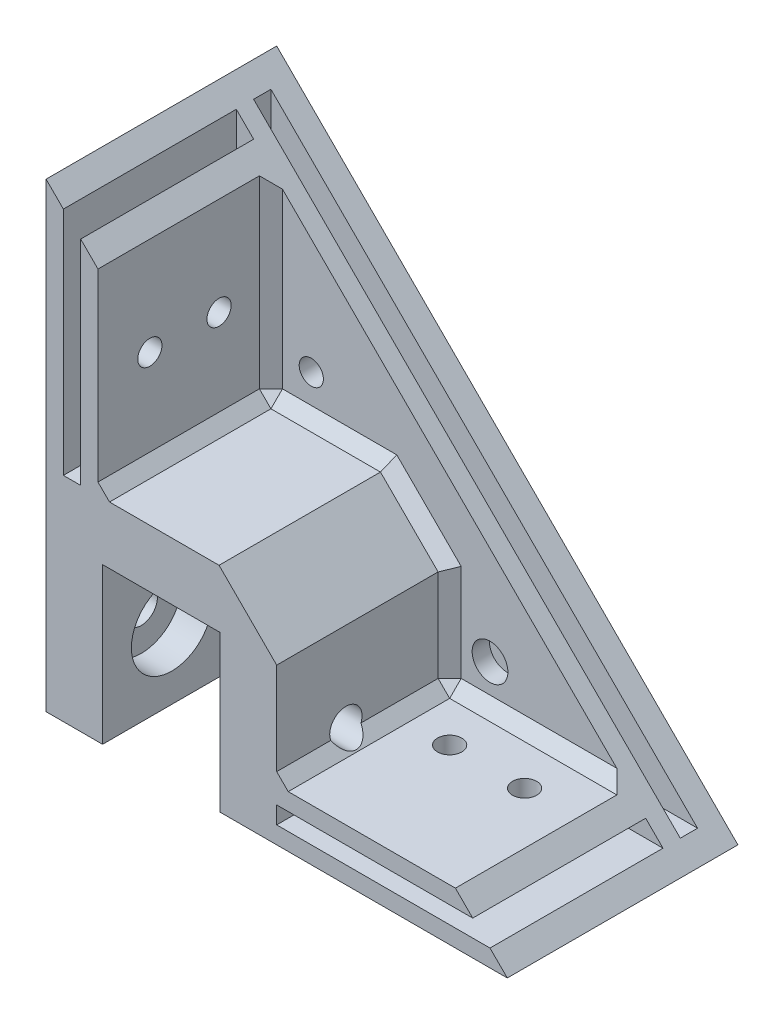
from build123d import *

# Parameters (mm, degrees)
DODANIE_WYCI_GNI_CIE1_DEPTH     = 4
DODANIE_WYCI_GNI_CIE2_DEPTH     = 3
DODANIE_WYCI_GNI_CIE3_DEPTH     = 3
DODANIE_WYCI_GNI_CIE4_DEPTH     = 30
WYTNIJ_WYCI_GNI_CIE1_DEPTH      = 15.5
WYTNIJ_WYCI_GNI_CIE1_DEPTH_BACK = 15.5
SZKIC5_R                        = 7
SZKIC6_R                        = 2.802594562
WYTNIJ_WYCI_GNI_CIE2_DEPTH      = 121
SFAZOWANIE1_SIZE                = 2
SZKIC7_R                        = 3.1
SZKIC7_R_2                      = 2.1
WYTNIJ_WYCI_GNI_CIE3_DEPTH      = 118.046999107
SZKIC8_R                        = 2.1
WYTNIJ_WYCI_GNI_CIE4_DEPTH      = 115.197197864
SZKIC9_R                        = 2.1
WYTNIJ_WYCI_GNI_CIE5_DEPTH      = 115.197197864


with BuildPart() as part:
    # Szkic1 → Dodanie-wyciągnięcie1 (new body)
    with BuildSketch(Plane.XY):
        Polygon((0, 0), (80, 0), (0, 80), align=None)
    extrude(amount=DODANIE_WYCI_GNI_CIE1_DEPTH)

    # Szkic2 → Dodanie-wyciągnięcie2 (add)
    with BuildSketch(Plane.XY.offset(4)):
        Polygon((3, 77), (3, 3), (77, 3), (80, 0), (0, 0), (0, 80), align=None)
    extrude(amount=DODANIE_WYCI_GNI_CIE2_DEPTH)

    # Szkic3 → Dodanie-wyciągnięcie3 (add)
    with BuildSketch(Plane.XY.offset(7)):
        Polygon((80, 0), (77, 3), (3, 77), (0, 80), (0, 0), align=None)
    extrude(amount=DODANIE_WYCI_GNI_CIE3_DEPTH)

    # Szkic4 → Dodanie-wyciągnięcie4 (add)
    with BuildSketch(Plane.XY.offset(10)):
        Polygon((30.2, 0), (80, 0), (77, 3), (40, 3), (40, 6), (74, 6), (71, 9), (40, 9), (40, 27), (30, 37), (9, 37), (9, 71), (6, 74), (6, 37), (3, 37), (3, 77), (0, 80), (0, 0), (9.8, 0), (9.8, 27), (30.2, 27), align=None)
    extrude(amount=DODANIE_WYCI_GNI_CIE4_DEPTH)

    # Szkic5 → Wytnij-wyciągnięcie1 (cut, two sides: drawn at the far end of the back side and taken through both)
    with BuildSketch(Plane(origin=(20, 0, 0), x_dir=(0, 0, -1), z_dir=(1, 0, 0)).offset(-WYTNIJ_WYCI_GNI_CIE1_DEPTH_BACK)):
        with Locations((-28, 12)):
            Circle(SZKIC5_R)
    extrude(amount=WYTNIJ_WYCI_GNI_CIE1_DEPTH + WYTNIJ_WYCI_GNI_CIE1_DEPTH_BACK, mode=Mode.SUBTRACT)

    # Szkic6 → Wytnij-wyciągnięcie2 (cut, through all)
    with BuildSketch(Plane.ZY):
        with Locations((28, 12)):
            Circle(SZKIC6_R)
    extrude(amount=-WYTNIJ_WYCI_GNI_CIE2_DEPTH, mode=Mode.SUBTRACT)

    # Sfazowanie1
    # the kernel refuses this chamfer: 2 mm, written as the material it adds along each edge
    with BuildSketch(Plane(origin=(10.333333333, 38.333333333, 11.333333333), x_dir=(-0.7071067811865475, 0.7071067811865475, 0), z_dir=(-0.5773502691896258, -0.5773502691896258, -0.5773502691896258))) as sfazowanie1_piece_1_section:
        Polygon((-1.414213562, -0.816496581), (1.414213562, -0.816496581), (0, 1.632993162), align=None)
    sfazowanie1_piece_1 = extrude(amount=2.540341184, mode=Mode.PRIVATE)
    sfazowanie1_piece_1 = split(sfazowanie1_piece_1, bisect_by=Plane(origin=(9, 37, 10), z_dir=(0, 1, 0)), keep=Keep.TOP, mode=Mode.PRIVATE)
    sfazowanie1_piece_1 = split(sfazowanie1_piece_1, bisect_by=Plane(origin=(9, 37, 10), z_dir=(1, 0, 0)), keep=Keep.TOP, mode=Mode.PRIVATE)
    sfazowanie1_piece_1 = split(sfazowanie1_piece_1, bisect_by=Plane(origin=(9, 37, 10), z_dir=(0, 0, 1)), keep=Keep.TOP, mode=Mode.PRIVATE)
    add(sfazowanie1_piece_1)
    with BuildSketch(Plane(origin=(41.333333333, 10.333333333, 11.333333333), x_dir=(0, -0.7071067811865475, 0.7071067811865475), z_dir=(-0.5773502691896258, -0.5773502691896258, -0.5773502691896258))) as sfazowanie1_piece_2_section:
        Polygon((-1.414213562, -0.816496581), (1.414213562, -0.816496581), (0, 1.632993162), align=None)
    sfazowanie1_piece_2 = extrude(amount=2.540341184, mode=Mode.PRIVATE)
    sfazowanie1_piece_2 = split(sfazowanie1_piece_2, bisect_by=Plane(origin=(40, 9, 10), z_dir=(0, 0, 1)), keep=Keep.TOP, mode=Mode.PRIVATE)
    sfazowanie1_piece_2 = split(sfazowanie1_piece_2, bisect_by=Plane(origin=(40, 9, 10), z_dir=(0, 1, 0)), keep=Keep.TOP, mode=Mode.PRIVATE)
    sfazowanie1_piece_2 = split(sfazowanie1_piece_2, bisect_by=Plane(origin=(40, 9, 10), z_dir=(1, 0, 0)), keep=Keep.TOP, mode=Mode.PRIVATE)
    add(sfazowanie1_piece_2)
    with BuildSketch(Plane(origin=(9, 37, 4.856634024), x_dir=(1, 0, 0), z_dir=(0, 0, 1))) as sfazowanie1_piece_3_section:
        Polygon((SFAZOWANIE1_SIZE, 0), (0, SFAZOWANIE1_SIZE), (0, 0), align=None)
    sfazowanie1_piece_3 = extrude(amount=35.143365976, mode=Mode.PRIVATE)
    sfazowanie1_piece_3 = split(sfazowanie1_piece_3, bisect_by=Plane(origin=(9, 37, 7), z_dir=(0, 0, 1)), keep=Keep.TOP, mode=Mode.PRIVATE)
    add(sfazowanie1_piece_3)
    with BuildSketch(Plane(origin=(76.143365976, 9, 10), x_dir=(0, 0, 1), z_dir=(-1, 0, 0))) as sfazowanie1_piece_4_section:
        Polygon((SFAZOWANIE1_SIZE, 0), (0, SFAZOWANIE1_SIZE), (0, 0), align=None)
    sfazowanie1_piece_4 = extrude(amount=41.286731952, mode=Mode.PRIVATE)
    sfazowanie1_piece_4 = split(sfazowanie1_piece_4, bisect_by=Plane(origin=(73.571682988, 6.428317012, 10), z_dir=(-0.7071067811865476, -0.7071067811865476, 0)), keep=Keep.TOP, mode=Mode.PRIVATE)
    add(sfazowanie1_piece_4)
    with BuildSketch(Plane(origin=(40, 9, 10), x_dir=(0, 0, 1), z_dir=(0, 1, 0))) as sfazowanie1_piece_5_section:
        Polygon((SFAZOWANIE1_SIZE, 0), (0, SFAZOWANIE1_SIZE), (0, 0), align=None)
    sfazowanie1_piece_5 = extrude(amount=23.143365976, mode=Mode.PRIVATE)
    sfazowanie1_piece_5 = split(sfazowanie1_piece_5, bisect_by=Plane(origin=(49, 18, 10), z_dir=(-0.7071067811865482, -0.7071067811865468, 0)), keep=Keep.TOP, mode=Mode.PRIVATE)
    add(sfazowanie1_piece_5)
    with BuildSketch(Plane(origin=(40, 9, 4.856634024), x_dir=(1, 0, 0), z_dir=(0, 0, 1))) as sfazowanie1_piece_6_section:
        Polygon((SFAZOWANIE1_SIZE, 0), (0, SFAZOWANIE1_SIZE), (0, 0), align=None)
    sfazowanie1_piece_6 = extrude(amount=35.143365976, mode=Mode.PRIVATE)
    sfazowanie1_piece_6 = split(sfazowanie1_piece_6, bisect_by=Plane(origin=(40, 9, 7), z_dir=(0, 0, 1)), keep=Keep.TOP, mode=Mode.PRIVATE)
    sfazowanie1_piece_6 = sfazowanie1_piece_6 - Plane(origin=(40, 12, 28), x_dir=(0, 0, 1), z_dir=(-1, 0, 0)) * Cylinder(2.802594562, 79, mode=Mode.PRIVATE)
    add(sfazowanie1_piece_6)
    with BuildSketch(Plane(origin=(43.63690896, 23.36309104, 10), x_dir=(0, 0, 1), z_dir=(-0.7071067811865468, 0.7071067811865482, 0))) as sfazowanie1_piece_7_section:
        Polygon((SFAZOWANIE1_SIZE, 0), (0, SFAZOWANIE1_SIZE), (0, 0), align=None)
    sfazowanie1_piece_7 = extrude(amount=24.428867576, mode=Mode.PRIVATE)
    sfazowanie1_piece_7 = split(sfazowanie1_piece_7, bisect_by=Plane(origin=(40, 23.36309104, 10), z_dir=(-1, 0, 0)), keep=Keep.TOP, mode=Mode.PRIVATE)
    sfazowanie1_piece_7 = split(sfazowanie1_piece_7, bisect_by=Plane(origin=(43.63690896, 37, 10), z_dir=(0, -1, 0)), keep=Keep.TOP, mode=Mode.PRIVATE)
    add(sfazowanie1_piece_7)
    with BuildSketch(Plane(origin=(9, 31.856634024, 10), x_dir=(0, 0, 1), z_dir=(0, 1, 0))) as sfazowanie1_piece_8_section:
        Polygon((SFAZOWANIE1_SIZE, 0), (0, SFAZOWANIE1_SIZE), (0, 0), align=None)
    sfazowanie1_piece_8 = extrude(amount=44.286731952, mode=Mode.PRIVATE)
    sfazowanie1_piece_8 = split(sfazowanie1_piece_8, bisect_by=Plane(origin=(28.571682988, 51.428317012, 10), z_dir=(-0.7071067811865476, -0.7071067811865476, 0)), keep=Keep.TOP, mode=Mode.PRIVATE)
    add(sfazowanie1_piece_8)
    with BuildSketch(Plane(origin=(35.143365976, 37, 10), x_dir=(0, 0, 1), z_dir=(-1, 0, 0))) as sfazowanie1_piece_9_section:
        Polygon((SFAZOWANIE1_SIZE, 0), (0, SFAZOWANIE1_SIZE), (0, 0), align=None)
    sfazowanie1_piece_9 = extrude(amount=31.286731952, mode=Mode.PRIVATE)
    sfazowanie1_piece_9 = split(sfazowanie1_piece_9, bisect_by=Plane(origin=(32.571682988, 34.428317012, 10), z_dir=(-0.7071067811865482, -0.7071067811865468, 0)), keep=Keep.TOP, mode=Mode.PRIVATE)
    sfazowanie1_piece_9 = split(sfazowanie1_piece_9, bisect_by=Plane(origin=(6, 37, 10), z_dir=(1, 0, 0)), keep=Keep.TOP, mode=Mode.PRIVATE)
    add(sfazowanie1_piece_9)
    with BuildSketch(Plane(origin=(40, 9, 10), x_dir=(0, 0, 1), z_dir=(0, 1, 0))) as sfazowanie1_piece_10a_section:
        Polygon((SFAZOWANIE1_SIZE, 0), (0, SFAZOWANIE1_SIZE), (0, 0), align=None)
    sfazowanie1_piece_10a = extrude(amount=23.143365976, mode=Mode.PRIVATE)
    sfazowanie1_piece_10a = split(sfazowanie1_piece_10a, bisect_by=Plane(origin=(49, 18, 10), z_dir=(0.7071067811865482, 0.7071067811865468, 0)), keep=Keep.TOP, mode=Mode.PRIVATE)
    with BuildSketch(Plane(origin=(43.63690896, 23.36309104, 10), x_dir=(0, 0, 1), z_dir=(-0.7071067811865468, 0.7071067811865482, 0))) as sfazowanie1_piece_10b_section:
        Polygon((SFAZOWANIE1_SIZE, 0), (0, SFAZOWANIE1_SIZE), (0, 0), align=None)
    sfazowanie1_piece_10b = extrude(amount=24.428867576, mode=Mode.PRIVATE)
    sfazowanie1_piece_10b = split(sfazowanie1_piece_10b, bisect_by=Plane(origin=(40, 23.36309104, 10), z_dir=(1, 0, 0)), keep=Keep.TOP, mode=Mode.PRIVATE)
    sfazowanie1_piece_10 = sfazowanie1_piece_10a & sfazowanie1_piece_10b
    add(sfazowanie1_piece_10)
    with BuildSketch(Plane(origin=(43.63690896, 23.36309104, 10), x_dir=(0, 0, 1), z_dir=(-0.7071067811865468, 0.7071067811865482, 0))) as sfazowanie1_piece_11a_section:
        Polygon((SFAZOWANIE1_SIZE, 0), (0, SFAZOWANIE1_SIZE), (0, 0), align=None)
    sfazowanie1_piece_11a = extrude(amount=24.428867576, mode=Mode.PRIVATE)
    sfazowanie1_piece_11a = split(sfazowanie1_piece_11a, bisect_by=Plane(origin=(43.63690896, 37, 10), z_dir=(0, 1, 0)), keep=Keep.TOP, mode=Mode.PRIVATE)
    with BuildSketch(Plane(origin=(35.143365976, 37, 10), x_dir=(0, 0, 1), z_dir=(-1, 0, 0))) as sfazowanie1_piece_11b_section:
        Polygon((SFAZOWANIE1_SIZE, 0), (0, SFAZOWANIE1_SIZE), (0, 0), align=None)
    sfazowanie1_piece_11b = extrude(amount=26.143365976, mode=Mode.PRIVATE)
    sfazowanie1_piece_11b = split(sfazowanie1_piece_11b, bisect_by=Plane(origin=(32.571682988, 34.428317012, 10), z_dir=(0.7071067811865482, 0.7071067811865468, 0)), keep=Keep.TOP, mode=Mode.PRIVATE)
    sfazowanie1_piece_11 = sfazowanie1_piece_11a & sfazowanie1_piece_11b
    add(sfazowanie1_piece_11)

    # Szkic7 → Wytnij-wyciągnięcie3 (cut, through all)
    with BuildSketch(Plane.XY.offset(10)):
        with Locations((47, 16)):
            Circle(SZKIC7_R)
        with Locations((16, 44)):
            Circle(SZKIC7_R_2)
    extrude(amount=-WYTNIJ_WYCI_GNI_CIE3_DEPTH, mode=Mode.SUBTRACT)

    # Szkic8 → Wytnij-wyciągnięcie4 (cut, through all)
    with BuildSketch(Plane(origin=(0, 9, 0), x_dir=(1, 0, 0), z_dir=(0, 1, 0))):
        with Locations(Location((49, -19, 0), (0, 0, 180))):
            Circle(SZKIC8_R)
        with Locations(Location((62, -19, 0), (0, 0, 180))):
            Circle(SZKIC8_R)
    extrude(amount=-WYTNIJ_WYCI_GNI_CIE4_DEPTH, mode=Mode.SUBTRACT)

    # Szkic9 → Wytnij-wyciągnięcie5 (cut, through all)
    with BuildSketch(Plane(origin=(9, 0, 0), x_dir=(0, 0, -1), z_dir=(1, 0, 0))):
        with Locations((-31, 54)):
            Circle(SZKIC9_R)
        with Locations((-19, 54)):
            Circle(SZKIC9_R)
    extrude(amount=-WYTNIJ_WYCI_GNI_CIE5_DEPTH, mode=Mode.SUBTRACT)


solid = part.part
